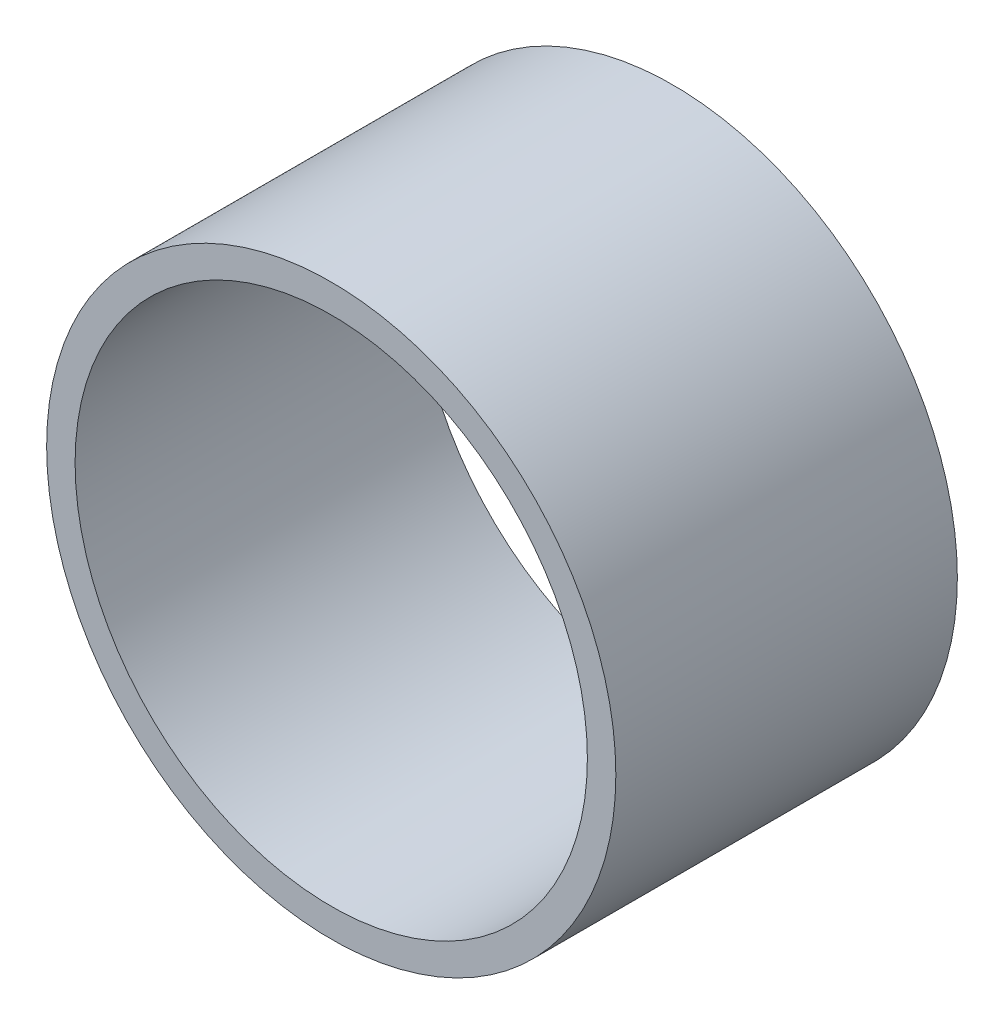
from build123d import *

# Parameters (mm, degrees)
ESQUISSE1_R        = 10
ESQUISSE1_R_2      = 9
BOSS_EXTRU_1_DEPTH = 12


with BuildPart() as part:
    # Esquisse1 → Boss.-Extru.1 (new body)
    with BuildSketch(Plane.XY):
        Circle(ESQUISSE1_R)
        Circle(ESQUISSE1_R_2, mode=Mode.SUBTRACT)
    extrude(amount=BOSS_EXTRU_1_DEPTH)


solid = part.part
